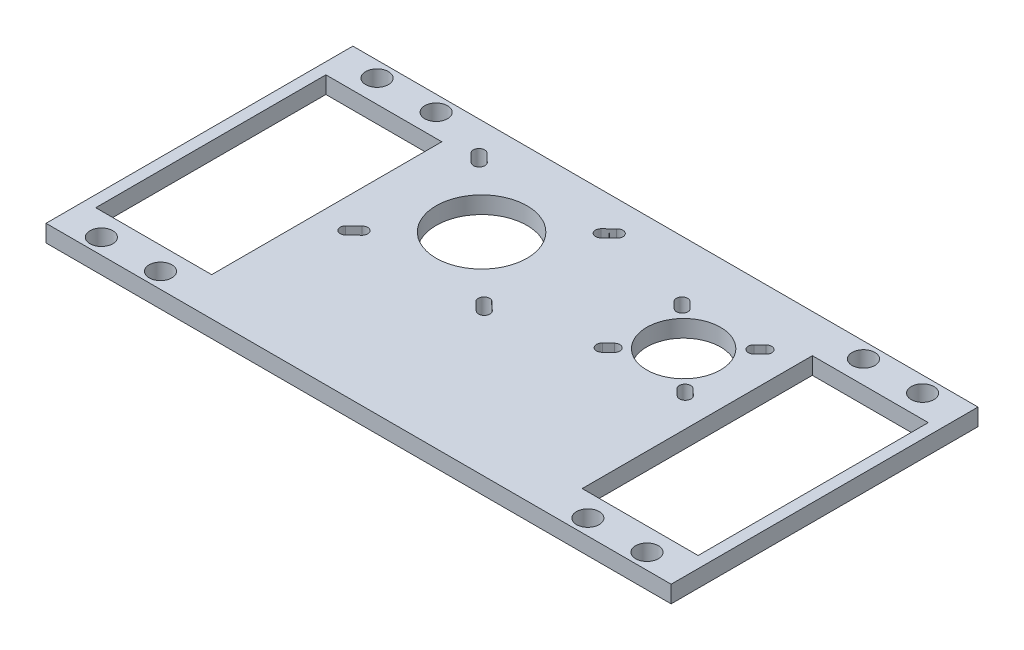
from build123d import *

# Parameters (mm, degrees)
ESQUISSE1_W             = 110
ESQUISSE1_H             = 54
BOSS_EXTRU_1_DEPTH      = 3
ESQUISSE2_R             = 2
ESQUISSE2_W             = 20.4
ESQUISSE2_H             = 40.5
ENL_V_MAT_EXTRU_1_DEPTH = 46
ESQUISSE3_R             = 8
ENL_V_MAT_EXTRU_2_DEPTH = 10
ESQUISSE3_3_R           = 6.5
ENL_V_MAT_EXTRU_3_DEPTH = 15


with BuildPart() as part:
    # Esquisse1 → Boss.-Extru.1 (new body)
    with BuildSketch(Plane(origin=(0, 0, 0), x_dir=(1, 0, 0), z_dir=(0, 1, 0))):
        with Locations((1, 8.02173913)):
            Rectangle(ESQUISSE1_W, ESQUISSE1_H)
    extrude(amount=BOSS_EXTRU_1_DEPTH)

    # Esquisse2 → Enlèv. mat.-Extru.1 (cut)
    with BuildSketch(Plane(origin=(0, 3, 0), x_dir=(1, 0, 0), z_dir=(0, 1, 0))):
        with Locations((-47, 32.27173913)):
            Circle(ESQUISSE2_R)
        with Locations((-36.6, 32.27173913)):
            Circle(ESQUISSE2_R)
        with Locations((-47, -16.22826087)):
            Circle(ESQUISSE2_R)
        with Locations((-36.6, -16.22826087)):
            Circle(ESQUISSE2_R)
        with Locations((38.6, 32.27173913)):
            Circle(ESQUISSE2_R)
        with Locations((49, 32.27173913)):
            Circle(ESQUISSE2_R)
        with Locations((38.6, -16.22826087)):
            Circle(ESQUISSE2_R)
        with Locations((49, -16.22826087)):
            Circle(ESQUISSE2_R)
        with Locations((-41.8, 8.02173913)):
            Rectangle(ESQUISSE2_W, ESQUISSE2_H)
        with Locations((43.8, 8.02173913)):
            Rectangle(ESQUISSE2_W, ESQUISSE2_H)
    extrude(amount=-ENL_V_MAT_EXTRU_1_DEPTH, mode=Mode.SUBTRACT)

    # Esquisse3 → Enlèv. mat.-Extru.2 (cut)
    # profile 1 of 5: a face of its own
    with BuildSketch(Plane(origin=(0, 3, 0), x_dir=(1, 0, 0), z_dir=(0, 1, 0))):
        with BuildLine():
            ThreePointArc((-2.853212891, 8.352121882), (-4.239560885, 8.342742313), (-4.284222232, 6.957082145))
            Line((-4.284222232, 6.957082145), (-2.794071168, 5.520408016))
            ThreePointArc((-2.794071168, 5.520408016), (-2.081119908, 5.240492653), (-1.379244694, 5.547124831))
            ThreePointArc((-1.379244694, 5.547124831), (-1.100190097, 6.259812023), (-1.406818642, 6.961077618))
            Line((-1.406818642, 6.961077618), (-2.853212891, 8.352121882))
        make_face()
    # profile 2 of 5: a face of its own
    with BuildSketch(Plane(origin=(0, 3, 0), x_dir=(1, 0, 0), z_dir=(0, 1, 0))):
        with BuildLine():
            Line((-2.946598895, 30.368373979), (-4.339317042, 29.036187436))
            ThreePointArc((-4.339317042, 29.036187436), (-4.338421569, 27.643742271), (-2.946598895, 27.602101147))
            Line((-2.946598895, 27.602101147), (-1.486460884, 29.005937397))
            ThreePointArc((-1.486460884, 29.005937397), (-1.497310818, 30.45795054), (-2.946598895, 30.368373979))
        make_face()
        with BuildLine():
            Line((-2.946598895, 29.078751818), (-2.946598895, 29.085237293))
            ThreePointArc((-2.946598895, 29.085237293), (-2.923891235, 29.059025101), (-2.900288323, 29.033616059))
            ThreePointArc((-2.900288323, 29.033616059), (-2.923078661, 29.056558386), (-2.946598895, 29.078751818))
        make_face(mode=Mode.SUBTRACT)
    # profile 3 of 5: a face of its own
    with BuildSketch(Plane(origin=(0, 3, 0), x_dir=(1, 0, 0), z_dir=(0, 1, 0))):
        with BuildLine():
            ThreePointArc((-27.268724522, 6.980213998), (-27.25388726, 5.637030161), (-25.915693612, 5.520408016))
            Line((-25.915693612, 5.520408016), (-24.388077775, 6.980213998))
            ThreePointArc((-24.388077775, 6.980213998), (-24.35598558, 8.394063386), (-25.769834968, 8.42615558))
            Line((-25.769834968, 8.42615558), (-27.268724522, 6.980213998))
        make_face()
    # profile 4 of 5: a face of its own
    with BuildSketch(Plane(origin=(0, 3, 0), x_dir=(1, 0, 0), z_dir=(0, 1, 0))):
        with BuildLine():
            ThreePointArc((-25.922899604, 30.539187517), (-27.328367406, 30.488483643), (-27.293189577, 29.082541558))
            Line((-27.293189577, 29.082541558), (-25.851678965, 27.696162405))
            ThreePointArc((-25.851678965, 27.696162405), (-24.437692265, 27.723771617), (-24.46538678, 29.137756649))
            Line((-24.46538678, 29.137756649), (-25.922899604, 30.539187517))
        make_face()
        with BuildLine():
            ThreePointArc((-25.879244694, 29.110107288), (-25.883082581, 29.106094542), (-25.886898128, 29.102060549))
            Line((-25.886898128, 29.102060549), (-25.887293629, 29.117848386))
            Line((-25.887293629, 29.117848386), (-25.879244694, 29.110107288))
        make_face(mode=Mode.SUBTRACT)
    # profile 5 of 5: a face of its own
    with BuildSketch(Plane(origin=(0, 3, 0), x_dir=(1, 0, 0), z_dir=(0, 1, 0))):
        with Locations((-14.35, 18.021805636)):
            Circle(ESQUISSE3_R)
    extrude(amount=-ENL_V_MAT_EXTRU_2_DEPTH, mode=Mode.SUBTRACT)


with BuildPart() as enl_v_mat_extru_2_piece_1:
    # of the separate pieces the step leaves, piece 1, a body of its own (enl_v_mat_extru_2_pieces)
    add(part.part.solids().sort_by_distance((-54, 0, -35.02173913))[0])

    # Esquisse3<3> → Enlèv. mat.-Extru.3 (cut)
    with BuildSketch(Plane(origin=(0, 3, 0), x_dir=(1, 0, 0), z_dir=(0, 1, 0))):
        with BuildLine():
            Line((28.210548289, 23.366386245), (29.292571762, 24.405243888))
            ThreePointArc((29.292571762, 24.405243888), (29.321348982, 25.819164632), (27.907428238, 25.847941852))
            Line((27.907428238, 25.847941852), (26.825404764, 24.809084209))
            ThreePointArc((26.825404764, 24.809084209), (26.796627544, 23.395163465), (28.210548289, 23.366386245))
        make_face()
        with Locations((21.2, 18.021805636)):
            Circle(ESQUISSE3_3_R)
        with BuildLine():
            ThreePointArc((14.575674255, 25.768154618), (13.161753511, 25.739377398), (13.190530731, 24.325456654))
            Line((13.190530731, 24.325456654), (14.272554204, 23.286599011))
            ThreePointArc((14.272554204, 23.286599011), (15.686474949, 23.315376231), (15.657697729, 24.729296975))
            Line((15.657697729, 24.729296975), (14.575674255, 25.768154618))
        make_face()
        with BuildLine():
            ThreePointArc((27.824325745, 10.275456654), (29.238246489, 10.304233874), (29.209469269, 11.718154618))
            Line((29.209469269, 11.718154618), (28.127445796, 12.757012262))
            ThreePointArc((28.127445796, 12.757012262), (26.713525051, 12.728235042), (26.742302271, 11.314314297))
            Line((26.742302271, 11.314314297), (27.824325745, 10.275456654))
        make_face()
        with BuildLine():
            ThreePointArc((13.190530731, 11.718154618), (13.161753511, 10.304233874), (14.575674255, 10.275456654))
            Line((14.575674255, 10.275456654), (15.657697729, 11.314314297))
            ThreePointArc((15.657697729, 11.314314297), (15.686474949, 12.728235042), (14.272554204, 12.757012262))
            Line((14.272554204, 12.757012262), (13.190530731, 11.718154618))
        make_face()
    extrude(amount=-ENL_V_MAT_EXTRU_3_DEPTH, mode=Mode.SUBTRACT)


with BuildPart() as enl_v_mat_extru_2_piece_2:
    # of the separate pieces the step leaves, piece 2, a body of its own (enl_v_mat_extru_2_pieces)
    add(part.part.solids().sort_by_distance((-2.946598895, 0, -29.085237293))[0])


with BuildPart() as enl_v_mat_extru_2_piece_3:
    # of the separate pieces the step leaves, piece 3, a body of its own (enl_v_mat_extru_2_pieces)
    add(part.part.solids().sort_by_distance((-25.879244694, 0, -29.110107288))[0])


solid = Compound([enl_v_mat_extru_2_piece_1.part, enl_v_mat_extru_2_piece_2.part, enl_v_mat_extru_2_piece_3.part])
